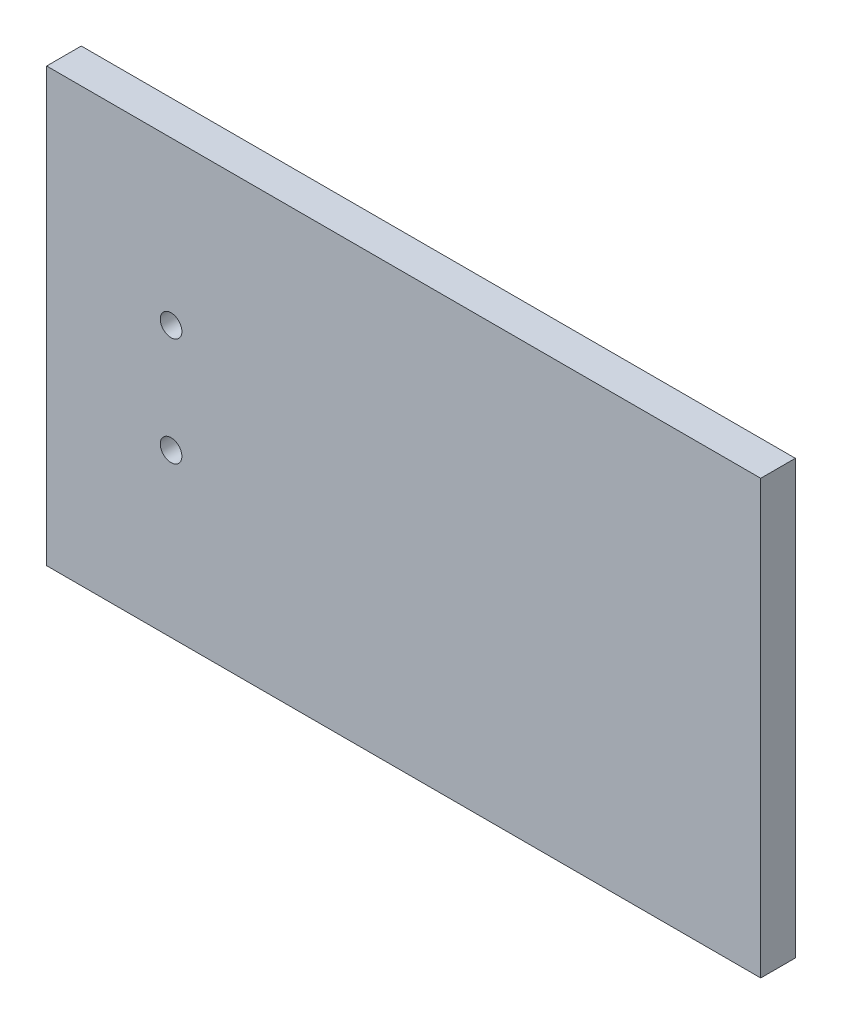
from build123d import *

# Parameters (mm, degrees)
SKETCH11_W                      = 66
SKETCH11_H                      = 40
HOLE_SIDE_THING_DEPTH           = 3.2
SKETCH12_R                      = 1
HOLES_FOR_HOLE_SIDE_THING_DEPTH = 3.2


with BuildPart() as part:
    # Sketch11 → Hole Side Thing (new body)
    with BuildSketch(Plane.XY):
        Rectangle(SKETCH11_W, SKETCH11_H)
    extrude(amount=HOLE_SIDE_THING_DEPTH)

    # Sketch12 → Holes for Hole Side Thing (cut)
    with BuildSketch(Plane.XY.offset(3.2)):
        with Locations((-21.5, 5)):
            Circle(SKETCH12_R)
        with Locations((-21.5, -5)):
            Circle(SKETCH12_R)
    extrude(amount=-HOLES_FOR_HOLE_SIDE_THING_DEPTH, mode=Mode.SUBTRACT)


solid = part.part
